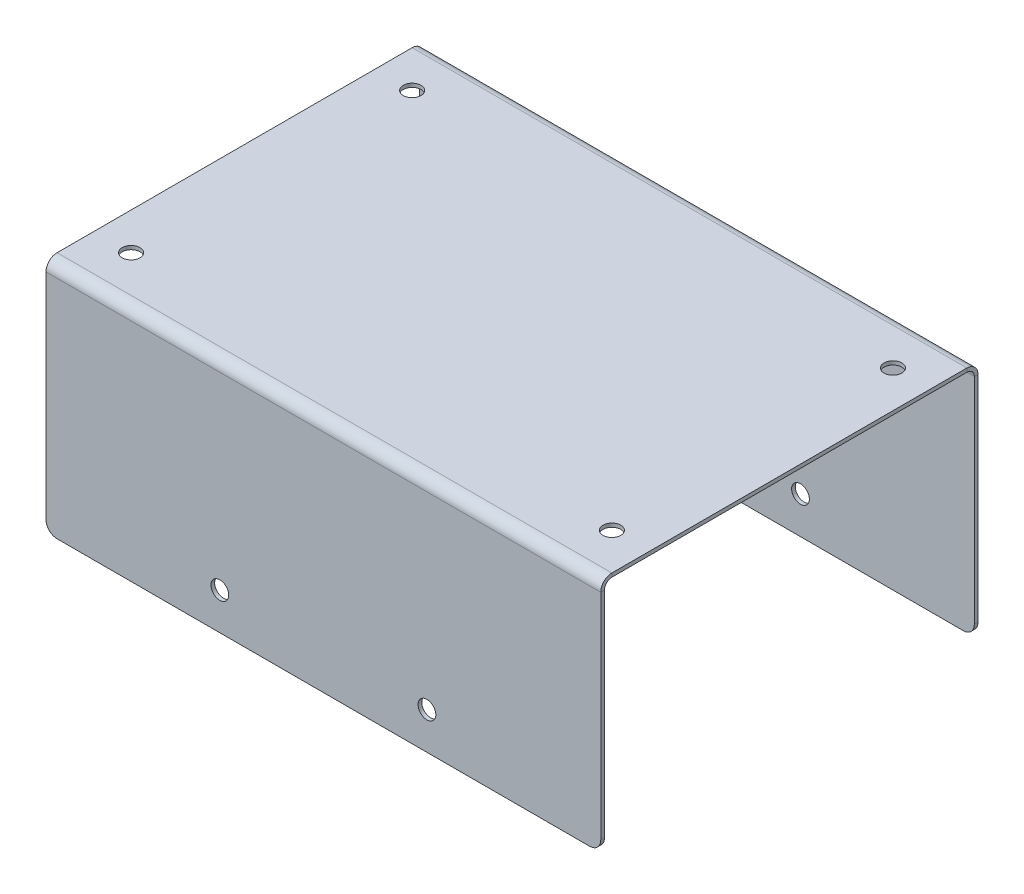
from build123d import *

# Parameters (mm, degrees)
SKETCH1_W                      = 150
SKETCH1_H                      = 100
BASE_FLANGE1_DEPTH             = 1
EDGE_FLANGE1_STRIP_W           = 8
EDGE_FLANGE1_STRIP_H           = 1
EDGE_FLANGE1_STRIP_CUT_DEPTH   = 150
EDGE_FLANGE1_STRIP_2_W         = 8
EDGE_FLANGE1_STRIP_2_H         = 1
EDGE_FLANGE1_STRIP_CUT_2_DEPTH = 150
EDGE_FLANGE1_DEPTH             = 150
EDGE_FLANGE1_BEND_DEPTH        = 150
BREAK_CORNER1_START            = -51
BREAK_CORNER1_DEPTH            = 102
M4_CLEARANCE_HOLE1_D           = 4.8
M4_CLEARANCE_HOLE2_D           = 4.8


# Read off the part's stored shape, not the designer's step: Break-Corner1
# Sheet-metal steps are written as plain solids
with BuildPart() as part:
    # Sketch1 → Base-Flange1 (new body)
    with BuildSketch(Plane(origin=(0, 0, 0), x_dir=(1, 0, 0), z_dir=(0, 1, 0))):
        Rectangle(SKETCH1_W, SKETCH1_H)
    extrude(amount=-BASE_FLANGE1_DEPTH)

    # Edge-Flange1 strip (across the edge) → Edge-Flange1 strip cut (cut)
    with BuildSketch(Plane(origin=(-75, -1, -50), x_dir=(0, 0, 1), z_dir=(1, 0, 0))):
        with Locations((-2, -0.5)):
            Rectangle(EDGE_FLANGE1_STRIP_W, EDGE_FLANGE1_STRIP_H)
    extrude(amount=EDGE_FLANGE1_STRIP_CUT_DEPTH, mode=Mode.SUBTRACT)

    # Edge-Flange1 strip 2 (across the edge) → Edge-Flange1 strip cut 2 (cut)
    with BuildSketch(Plane(origin=(75, -1, 50), x_dir=(0, 0, -1), z_dir=(-1, 0, 0))):
        with Locations((-2, -0.5)):
            Rectangle(EDGE_FLANGE1_STRIP_2_W, EDGE_FLANGE1_STRIP_2_H)
    extrude(amount=EDGE_FLANGE1_STRIP_CUT_2_DEPTH, mode=Mode.SUBTRACT)

    # Edge-Flange1 section (across the edge) → Edge-Flange1 (add)
    with BuildSketch(Plane(origin=(-75, -1, -50), x_dir=(0, 0, 1), z_dir=(1, 0, 0))):
        with BuildLine():
            Line((-1, 2), (-1, 63))
            Line((-1, 63), (0, 63))
            Line((0, 63), (0, 2))
            ThreePointArc((0, 2), (0.585786438, 0.585786438), (2, 0))
            Line((2, 0), (2, -1))
            ThreePointArc((2, -1), (-0.121320344, -0.121320344), (-1, 2))
        make_face()
    extrude(amount=EDGE_FLANGE1_DEPTH)

    # Edge-Flange1 section 2 (across the edge) → Edge-Flange1 bend (add)
    with BuildSketch(Plane(origin=(75, -1, 50), x_dir=(0, 0, -1), z_dir=(-1, 0, 0))):
        with BuildLine():
            Line((-1, 2), (-1, 63))
            Line((-1, 63), (0, 63))
            Line((0, 63), (0, 2))
            ThreePointArc((0, 2), (0.585786438, 0.585786438), (2, 0))
            Line((2, 0), (2, -1))
            ThreePointArc((2, -1), (-0.121320344, -0.121320344), (-1, 2))
        make_face()
    extrude(amount=EDGE_FLANGE1_BEND_DEPTH)

    # Break-Corner1 outline → Break-Corner1 (cut)
    with BuildSketch(Plane.XY.offset(BREAK_CORNER1_START)):
        with BuildLine():
            Line((-75, -64), (-72, -64))
            ThreePointArc((-72, -64), (-74.121320344, -63.121320344), (-75, -61))
            Line((-75, -61), (-75, -64))
        make_face()
        with BuildLine():
            ThreePointArc((75, -61), (74.121320344, -63.121320344), (72, -64))
            Line((72, -64), (75, -64))
            Line((75, -64), (75, -61))
        make_face()
    extrude(amount=BREAK_CORNER1_DEPTH, mode=Mode.SUBTRACT)

    # M4 Clearance Hole1 (through all)
    with Locations(Plane(origin=(0, 0, -51), x_dir=(-1, 0, 0), z_dir=(0, 0, -1))):
        with Locations((-28, -54), (28, -54)):
            Hole(M4_CLEARANCE_HOLE1_D / 2)

    # M4 Clearance Hole2 (through all)
    with Locations(Plane(origin=(0, 0, 0), x_dir=(1, 0, 0), z_dir=(0, 1, 0))):
        with Locations((-65, 38), (-65, -38), (65, -38), (65, 38)):
            Hole(M4_CLEARANCE_HOLE2_D / 2)


solid = part.part
